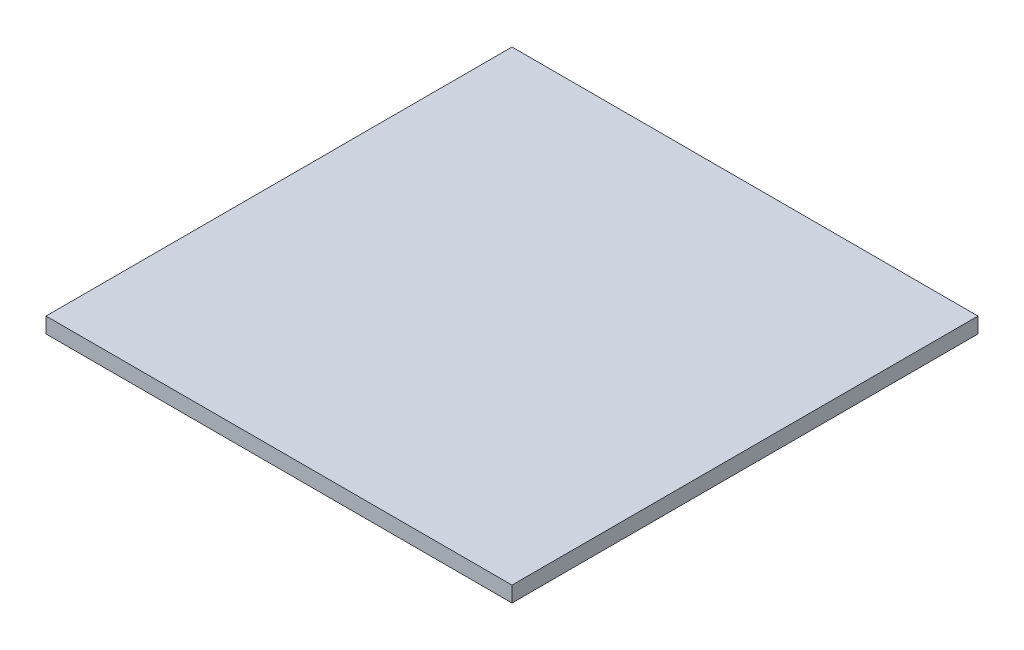
from build123d import *

# Parameters (mm, degrees)
SKETCH1_W           = 152.4
SKETCH1_H           = 152.4
BOSS_EXTRUDE1_DEPTH = 5.08


with BuildPart() as part:
    # Sketch1 → Boss-Extrude1 (new body)
    with BuildSketch(Plane(origin=(0, 0, 0), x_dir=(1, 0, 0), z_dir=(0, 1, 0))):
        Rectangle(SKETCH1_W, SKETCH1_H)
    extrude(amount=BOSS_EXTRUDE1_DEPTH)


solid = part.part
